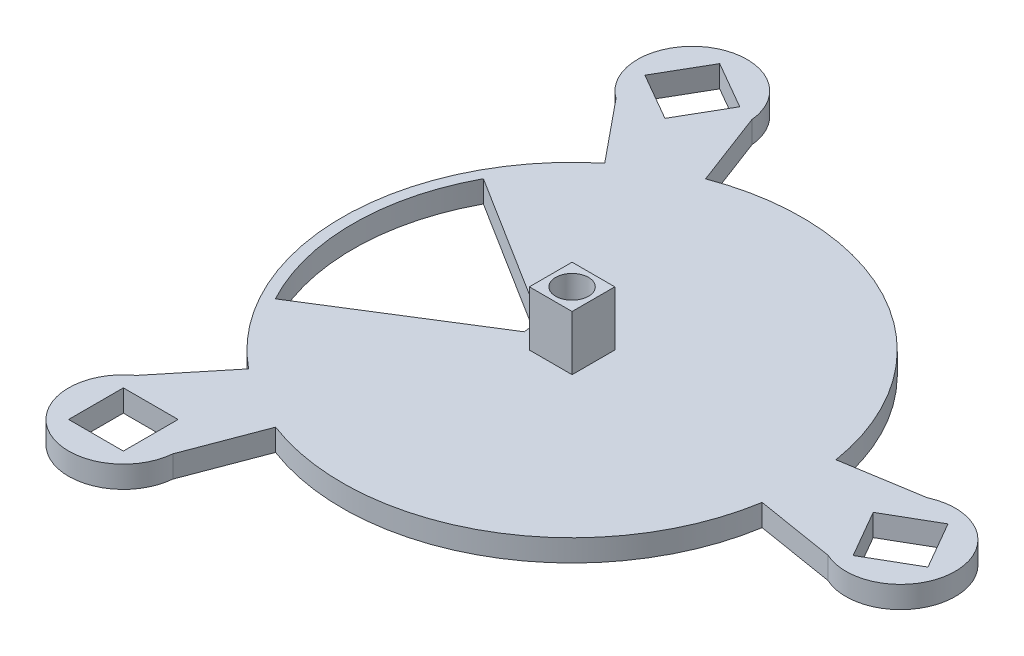
from build123d import *

# Parameters (mm, degrees)
SKETCH1_W           = 5
SKETCH1_H           = 5
BOSS_EXTRUDE1_DEPTH = 2
SKETCH2_W           = 3.9
SKETCH2_H           = 3.9
BOSS_EXTRUDE2_DEPTH = 5
CUT_EXTRUDE1_REACH  = 49.263
SKETCH3_R           = 1.5
CUT_EXTRUDE2_REACH  = 49.009


with BuildPart() as part:
    # Sketch1 → Boss-Extrude1 (new body)
    with BuildSketch(Plane(origin=(0, 0, 0), x_dir=(1, 0, 0), z_dir=(0, 1, 0))):
        with BuildLine():
            ThreePointArc((-7.442772198, -19.636831262), (10.5, -18.186533479), (20.727380822, -3.372785833))
            Line((20.727380822, -3.372785833), (27.907701299, -4.541176736))
            ThreePointArc((27.907701299, -4.541176736), (35, 0), (27.907701299, 4.541176736))
            Line((27.907701299, 4.541176736), (20.727380822, 3.372785833))
            ThreePointArc((20.727380822, 3.372785833), (10.5, 18.186533479), (-7.442772198, 19.636831262))
            Line((-7.442772198, 19.636831262), (-10.021076233, 26.439366654))
            ThreePointArc((-10.021076233, 26.439366654), (-17.5, 30.310889132), (-17.886625066, 21.898189918))
            Line((-17.886625066, 21.898189918), (-13.284608624, 16.264045429))
            ThreePointArc((-13.284608624, 16.264045429), (-21, 0), (-13.284608624, -16.264045429))
            Line((-13.284608624, -16.264045429), (-17.886625066, -21.898189918))
            ThreePointArc((-17.886625066, -21.898189918), (-17.5, -30.310889132), (-10.021076233, -26.439366654))
            Line((-10.021076233, -26.439366654), (-7.442772198, -19.636831262))
        make_face()
        with Locations((-15, -25.980762114)):
            Rectangle(SKETCH1_W, SKETCH1_H, mode=Mode.SUBTRACT)
        Polygon((26.584936491, 0.915063509), (30.915063509, 3.415063509), (33.415063509, -0.915063509), (29.084936491, -3.415063509), align=None, mode=Mode.SUBTRACT)
        Polygon((-11.584936491, 26.895825623), (-14.084936491, 22.565698604), (-18.415063509, 25.065698604), (-15.915063509, 29.395825623), align=None, mode=Mode.SUBTRACT)
    extrude(amount=BOSS_EXTRUDE1_DEPTH)

    # Sketch2 → Boss-Extrude2 (add)
    with BuildSketch(Plane(origin=(0, 2, 0), x_dir=(1, 0, 0), z_dir=(0, 1, 0))):
        Rectangle(SKETCH2_W, SKETCH2_H)
    extrude(amount=BOSS_EXTRUDE2_DEPTH)

    # Sketch3 → Cut-Extrude1 (cut, up to next)
    with BuildSketch(Plane(origin=(0, 7, 0), x_dir=(1, 0, 0), z_dir=(0, 1, 0)), mode=Mode.PRIVATE) as cut_extrude1_sk1:
        Circle(SKETCH3_R)
    cut_extrude1_tool1 = extrude(cut_extrude1_sk1.sketch, amount=-CUT_EXTRUDE1_REACH, mode=Mode.PRIVATE) & part.part
    add(cut_extrude1_tool1.solids().sort_by_distance((0, 7, 0))[0], mode=Mode.SUBTRACT)

    # Sketch4 → Cut-Extrude2 (cut, up to next)
    with BuildSketch(Plane(origin=(0, 2, 0), x_dir=(1, 0, 0), z_dir=(0, 1, 0)), mode=Mode.PRIVATE) as cut_extrude2_sk1:
        with BuildLine():
            Line((-3.620274752, -0.735), (-17.599715907, -9.5))
            ThreePointArc((-17.599715907, -9.5), (-20, 0), (-17.599715907, 9.5))
            Line((-17.599715907, 9.5), (-3.620274752, 0.735))
            ThreePointArc((-3.620274752, 0.735), (-3.694132412, 0), (-3.620274752, -0.735))
        make_face()
    cut_extrude2_tool1 = extrude(cut_extrude2_sk1.sketch, amount=-CUT_EXTRUDE2_REACH, mode=Mode.PRIVATE) & part.part
    add(cut_extrude2_tool1.solids().sort_by_distance((-13.664779, 2, 0))[0], mode=Mode.SUBTRACT)


solid = part.part
